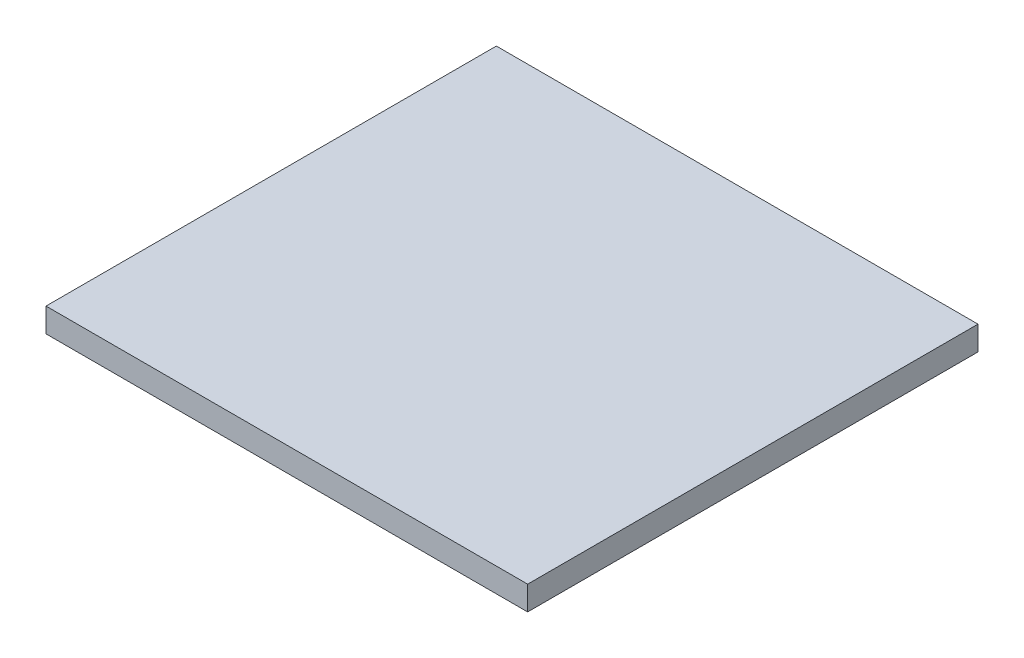
from build123d import *

# Parameters (mm, degrees)
SKETCH1_W           = 200
SKETCH1_H           = 187
BOSS_EXTRUDE1_DEPTH = 10


with BuildPart() as part:
    # Sketch1 → Boss-Extrude1 (new body)
    with BuildSketch(Plane(origin=(0, 0, 0), x_dir=(1, 0, 0), z_dir=(0, 1, 0))):
        Rectangle(SKETCH1_W, SKETCH1_H)
    extrude(amount=BOSS_EXTRUDE1_DEPTH)


solid = part.part
